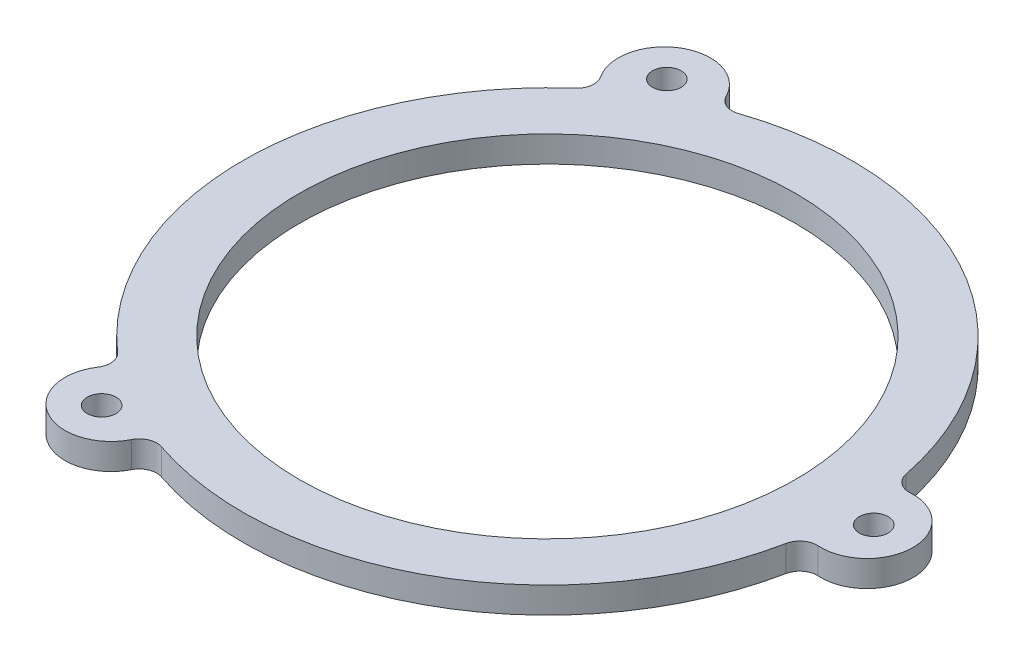
from build123d import *

# Parameters (mm, degrees)
SKETCH1_R           = 35
SKETCH1_R_2         = 28.5
BOSS_EXTRUDE1_DEPTH = 3
BOSS_EXTRUDE2_START = -3
BOSS_EXTRUDE2_DEPTH = 3
FILLET1_R           = 2
SKETCH6_R           = 1.65
CUT_EXTRUDE2_DEPTH  = 10


with BuildPart() as part:
    # Sketch1 → Boss-Extrude1 (new body)
    with BuildSketch(Plane(origin=(0, 0, 0), x_dir=(1, 0, 0), z_dir=(0, 1, 0))):
        Circle(SKETCH1_R)
        Circle(SKETCH1_R_2, mode=Mode.SUBTRACT)
    extrude(amount=BOSS_EXTRUDE1_DEPTH)

    # Sketch3 → Boss-Extrude2 (add)
    with BuildSketch(Plane(origin=(0, 3, 0), x_dir=(1, 0, 0), z_dir=(0, 1, 0)).offset(BOSS_EXTRUDE2_START)):
        with BuildLine():
            ThreePointArc((34.659382406, 4.871058534), (35, 0), (34.659382406, -4.871058534))
            ThreePointArc((34.659382406, -4.871058534), (42.018230209, 0), (34.659382406, 4.871058534))
        make_face()
        with BuildLine():
            ThreePointArc((-13.11123077, -32.45143491), (-17.5, -30.310889132), (-21.548151636, -27.580376376))
            ThreePointArc((-21.548151636, -27.580376376), (-20.999170932, -36.371630971), (-13.11123077, -32.45143491))
        make_face()
        with BuildLine():
            ThreePointArc((-13.11123077, 32.45143491), (-17.5, 30.310889132), (-21.548151636, 27.580376376))
            ThreePointArc((-21.548151636, 27.580376376), (-21.004952951, 36.381645722), (-13.11123077, 32.45143491))
        make_face()
    extrude(amount=BOSS_EXTRUDE2_DEPTH)

    # Fillet1
    fillet1_edges = [part.edges().sort_by_distance(p)[0] for p in [
        (-13.11123077, 1.5, -32.45143491),
        (-21.548151636, 1.5, -27.580376376),
        (-21.548151636, 1.5, 27.580376376),
        (-13.11123077, 1.5, 32.45143491),
        (34.659382406, 1.5, 4.871058534),
        (34.659382406, 1.5, -4.871058534),
    ]]
    fillet(fillet1_edges, radius=FILLET1_R)

    # Sketch6 → Cut-Extrude2 (cut)
    with BuildSketch(Plane(origin=(0, 3, 0), x_dir=(1, 0, 0), z_dir=(0, 1, 0))):
        with Locations((37.5, 0)):
            Circle(SKETCH6_R)
        with Locations((-18.75, -32.475952642)):
            Circle(SKETCH6_R)
        with Locations((-18.75, 32.475952642)):
            Circle(SKETCH6_R)
    extrude(amount=-CUT_EXTRUDE2_DEPTH, mode=Mode.SUBTRACT)


solid = part.part
